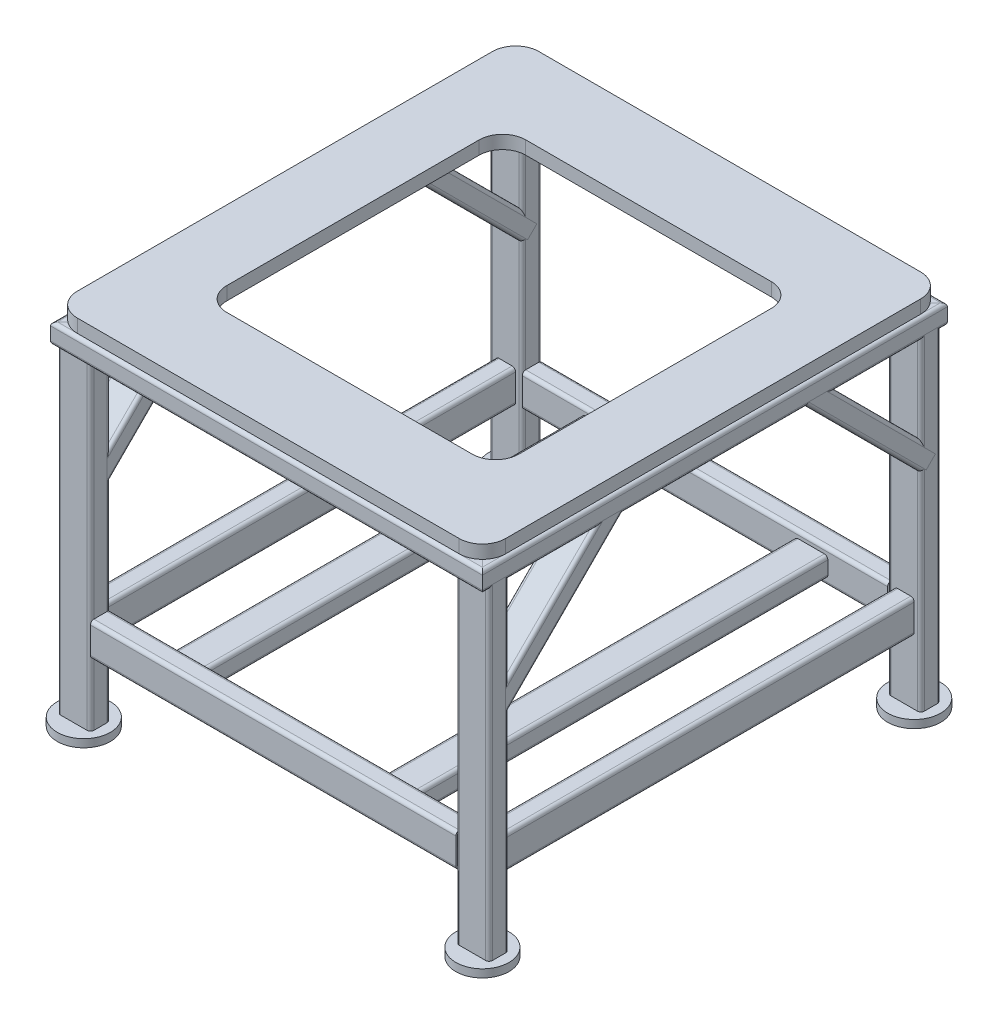
from build123d import *

# Parameters (mm, degrees)
RECTANGULAR_TUBE_50_X_30_X_2_6_1_DEPTH      = 630.154759474
RECTANGULAR_TUBE_50_X_30_X_2_6_1_DEPTH_BACK = 30.154759474
RECTANGULAR_TUBE_50_X_30_X_2_6_1_2_DEPTH    = 710.309518948
RECTANGULAR_TUBE_50_X_30_X_2_6_1_3_DEPTH    = 660.309518948
RECTANGULAR_TUBE_50_X_30_X_2_6_1_4_DEPTH    = 710.309518948
RECTANGULAR_START                           = -310
RECTANGULAR_TUBE_50_X_30_X_2_6_2_DEPTH      = 620
RECTANGULAR_START_2                         = -275
RECTANGULAR_TUBE_50_X_30_X_2_6_2_2_DEPTH    = 550
RECTANGULAR_START_3                         = -500
RECTANGULAR_TUBE_50_X_30_X_2_6_2_3_DEPTH    = 500
RECTANGULAR_TUBE_50_X_30_X_2_6_4_DEPTH      = 254.558441227
RECTANGULAR_TUBE_50_X_30_X_2_6_4_2_DEPTH    = 254.558441227
RECTANGULAR_TUBE_50_X_30_X_2_6_4_3_DEPTH    = 254.558441227
RECTANGULAR_TUBE_50_X_30_X_2_6_4_4_DEPTH    = 254.558441227
BOSS_EXTRUDE1_DEPTH                         = 20
SKETCH21_R                                  = 40
BOSS_EXTRUDE2_DEPTH                         = 12
BOSS_EXTRUDE2_2_DEPTH                       = 12
BOSS_EXTRUDE2_3_DEPTH                       = 12
BOSS_EXTRUDE2_4_DEPTH                       = 12


# Read off the part's stored shape, not the designer's step: Rectangular tube 50 X 30 X 2.6(2)
with BuildPart() as part:
    # Sketch1 → Rectangular tube 50 X 30 X 2.6(1) (new, two sides: drawn at the far end of the back side and taken through both)
    with BuildSketch(Plane(origin=(-300, 0, 325), x_dir=(0, 1, 0), z_dir=(1, 0, 0)).offset(-RECTANGULAR_TUBE_50_X_30_X_2_6_1_DEPTH_BACK)):
        with BuildLine():
            Line((-9.8, -25), (9.8, -25))
            ThreePointArc((9.8, -25), (13.476955262, -23.476955262), (15, -19.8))
            Line((15, -19.8), (15, 19.8))
            ThreePointArc((15, 19.8), (13.476955262, 23.476955262), (9.8, 25))
            Line((9.8, 25), (-9.8, 25))
            ThreePointArc((-9.8, 25), (-13.476955262, 23.476955262), (-15, 19.8))
            Line((-15, 19.8), (-15, -19.8))
            ThreePointArc((-15, -19.8), (-13.476955262, -23.476955262), (-9.8, -25))
        make_face()
        with BuildLine():
            Line((-9.8, -22.4), (9.8, -22.4))
            ThreePointArc((9.8, -22.4), (11.638477631, -21.638477631), (12.4, -19.8))
            Line((12.4, -19.8), (12.4, 19.8))
            ThreePointArc((12.4, 19.8), (11.638477631, 21.638477631), (9.8, 22.4))
            Line((9.8, 22.4), (-9.8, 22.4))
            ThreePointArc((-9.8, 22.4), (-11.638477631, 21.638477631), (-12.4, 19.8))
            Line((-12.4, 19.8), (-12.4, -19.8))
            ThreePointArc((-12.4, -19.8), (-11.638477631, -21.638477631), (-9.8, -22.4))
        make_face(mode=Mode.SUBTRACT)
    extrude(amount=RECTANGULAR_TUBE_50_X_30_X_2_6_1_DEPTH + RECTANGULAR_TUBE_50_X_30_X_2_6_1_DEPTH_BACK)

    # Rectangular tube 50 X 30 X 2.6(1) mitre 1
    split(bisect_by=Plane(origin=(-300, 0, 325), x_dir=(0, 1, 0), z_dir=(0.707106781, 0, 0.707106781)), keep=Keep.TOP)

    # Rectangular tube 50 X 30 X 2.6(1) mitre 2
    split(bisect_by=Plane(origin=(300, 0, 325), x_dir=(0, -1, 0), z_dir=(-0.707106781, 0, 0.707106781)), keep=Keep.TOP)


with BuildPart() as body_2:
    # Sketch1 on segment 2 (carried to segment 2) → Rectangular tube 50 X 30 X 2.6_1 2 (new body)
    with BuildSketch(Plane(origin=(300, 0, 355.154759474), x_dir=(0, 1, 0), z_dir=(0, 0, -1))):
        with BuildLine():
            Line((-9.8, -25), (9.8, -25))
            ThreePointArc((9.8, -25), (13.476955262, -23.476955262), (15, -19.8))
            Line((15, -19.8), (15, 19.8))
            ThreePointArc((15, 19.8), (13.476955262, 23.476955262), (9.8, 25))
            Line((9.8, 25), (-9.8, 25))
            ThreePointArc((-9.8, 25), (-13.476955262, 23.476955262), (-15, 19.8))
            Line((-15, 19.8), (-15, -19.8))
            ThreePointArc((-15, -19.8), (-13.476955262, -23.476955262), (-9.8, -25))
        make_face()
        with BuildLine():
            Line((-9.8, -22.4), (9.8, -22.4))
            ThreePointArc((9.8, -22.4), (11.638477631, -21.638477631), (12.4, -19.8))
            Line((12.4, -19.8), (12.4, 19.8))
            ThreePointArc((12.4, 19.8), (11.638477631, 21.638477631), (9.8, 22.4))
            Line((9.8, 22.4), (-9.8, 22.4))
            ThreePointArc((-9.8, 22.4), (-11.638477631, 21.638477631), (-12.4, 19.8))
            Line((-12.4, 19.8), (-12.4, -19.8))
            ThreePointArc((-12.4, -19.8), (-11.638477631, -21.638477631), (-9.8, -22.4))
        make_face(mode=Mode.SUBTRACT)
    extrude(amount=RECTANGULAR_TUBE_50_X_30_X_2_6_1_2_DEPTH)

    # Rectangular tube 50 X 30 X 2.6_1 2 mitre
    split(bisect_by=Plane(origin=(300, 0, -325), x_dir=(0, 1, 0), z_dir=(0.707106781, 0, 0.707106781)), keep=Keep.TOP)

    # Rectangular tube 50 X 30 X 2.6_1 2 m 2
    split(bisect_by=Plane(origin=(300, 0, 325), x_dir=(0, 1, 0), z_dir=(0.707106781, 0, -0.707106781)), keep=Keep.TOP)


with BuildPart() as body_3:
    # Sketch1 on segment 3 (carried to segment 3) → Rectangular tube 50 X 30 X 2.6_1 3 (new body)
    with BuildSketch(Plane(origin=(330.154759474, 0, -325), x_dir=(0, 1, 0), z_dir=(-1, 0, 0))):
        with BuildLine():
            Line((-9.8, -25), (9.8, -25))
            ThreePointArc((9.8, -25), (13.476955262, -23.476955262), (15, -19.8))
            Line((15, -19.8), (15, 19.8))
            ThreePointArc((15, 19.8), (13.476955262, 23.476955262), (9.8, 25))
            Line((9.8, 25), (-9.8, 25))
            ThreePointArc((-9.8, 25), (-13.476955262, 23.476955262), (-15, 19.8))
            Line((-15, 19.8), (-15, -19.8))
            ThreePointArc((-15, -19.8), (-13.476955262, -23.476955262), (-9.8, -25))
        make_face()
        with BuildLine():
            Line((-9.8, -22.4), (9.8, -22.4))
            ThreePointArc((9.8, -22.4), (11.638477631, -21.638477631), (12.4, -19.8))
            Line((12.4, -19.8), (12.4, 19.8))
            ThreePointArc((12.4, 19.8), (11.638477631, 21.638477631), (9.8, 22.4))
            Line((9.8, 22.4), (-9.8, 22.4))
            ThreePointArc((-9.8, 22.4), (-11.638477631, 21.638477631), (-12.4, 19.8))
            Line((-12.4, 19.8), (-12.4, -19.8))
            ThreePointArc((-12.4, -19.8), (-11.638477631, -21.638477631), (-9.8, -22.4))
        make_face(mode=Mode.SUBTRACT)
    extrude(amount=RECTANGULAR_TUBE_50_X_30_X_2_6_1_3_DEPTH)

    # Rectangular tube 50 X 30 X 2.6_1 3 mitre
    split(bisect_by=Plane(origin=(-300, 0, -325), x_dir=(0, 1, 0), z_dir=(0.707106781, 0, -0.707106781)), keep=Keep.TOP)

    # Rectangular tube 50 X 30 X 2.6_1 3 m 2
    split(bisect_by=Plane(origin=(300, 0, -325), x_dir=(0, -1, 0), z_dir=(-0.707106781, 0, -0.707106781)), keep=Keep.TOP)


with BuildPart() as body_4:
    # Sketch1 on segment 4 (carried to segment 4) → Rectangular tube 50 X 30 X 2.6_1 4 (new body)
    with BuildSketch(Plane(origin=(-300, 0, -355.154759474), x_dir=(0, 1, 0), z_dir=(0, 0, 1))):
        with BuildLine():
            Line((-9.8, -25), (9.8, -25))
            ThreePointArc((9.8, -25), (13.476955262, -23.476955262), (15, -19.8))
            Line((15, -19.8), (15, 19.8))
            ThreePointArc((15, 19.8), (13.476955262, 23.476955262), (9.8, 25))
            Line((9.8, 25), (-9.8, 25))
            ThreePointArc((-9.8, 25), (-13.476955262, 23.476955262), (-15, 19.8))
            Line((-15, 19.8), (-15, -19.8))
            ThreePointArc((-15, -19.8), (-13.476955262, -23.476955262), (-9.8, -25))
        make_face()
        with BuildLine():
            Line((-9.8, -22.4), (9.8, -22.4))
            ThreePointArc((9.8, -22.4), (11.638477631, -21.638477631), (12.4, -19.8))
            Line((12.4, -19.8), (12.4, 19.8))
            ThreePointArc((12.4, 19.8), (11.638477631, 21.638477631), (9.8, 22.4))
            Line((9.8, 22.4), (-9.8, 22.4))
            ThreePointArc((-9.8, 22.4), (-11.638477631, 21.638477631), (-12.4, 19.8))
            Line((-12.4, 19.8), (-12.4, -19.8))
            ThreePointArc((-12.4, -19.8), (-11.638477631, -21.638477631), (-9.8, -22.4))
        make_face(mode=Mode.SUBTRACT)
    extrude(amount=RECTANGULAR_TUBE_50_X_30_X_2_6_1_4_DEPTH)

    # Rectangular tube 50 X 30 X 2.6_1 4 mitre
    split(bisect_by=Plane(origin=(-300, 0, -325), x_dir=(0, -1, 0), z_dir=(-0.707106781, 0, 0.707106781)), keep=Keep.TOP)

    # Rectangular tube 50 X 30 X 2.6_1 4 m 2
    split(bisect_by=Plane(origin=(-300, 0, 325), x_dir=(0, -1, 0), z_dir=(-0.707106781, 0, -0.707106781)), keep=Keep.TOP)


with BuildPart() as body_5:
    # Rectangular tube 50 X 30 X 2.6(2) outline → Rectangular tube 50 X 30 X 2.6(2) (new body)
    # profile 1 of 4: a face of its own
    with BuildSketch(Plane.XY.offset(RECTANGULAR_START)):
        with BuildLine():
            Line((290.2, -405), (309.8, -405))
            ThreePointArc((309.8, -405), (313.476955262, -403.476955262), (315, -399.8))
            Line((315, -399.8), (315, -360.2))
            ThreePointArc((315, -360.2), (313.476955262, -356.523044738), (309.8, -355))
            Line((309.8, -355), (290.2, -355))
            ThreePointArc((290.2, -355), (286.523044738, -356.523044738), (285, -360.2))
            Line((285, -360.2), (285, -399.8))
            ThreePointArc((285, -399.8), (286.523044738, -403.476955262), (290.2, -405))
        make_face()
        with BuildLine():
            ThreePointArc((290.2, -402.4), (288.361522369, -401.638477631), (287.6, -399.8))
            Line((287.6, -399.8), (287.6, -360.2))
            ThreePointArc((287.6, -360.2), (288.361522369, -358.361522369), (290.2, -357.6))
            Line((290.2, -357.6), (309.8, -357.6))
            ThreePointArc((309.8, -357.6), (311.638477631, -358.361522369), (312.4, -360.2))
            Line((312.4, -360.2), (312.4, -399.8))
            ThreePointArc((312.4, -399.8), (311.638477631, -401.638477631), (309.8, -402.4))
            Line((309.8, -402.4), (290.2, -402.4))
        make_face(mode=Mode.SUBTRACT)
    # profile 2 of 4: a face of its own
    with BuildSketch(Plane.XY.offset(RECTANGULAR_START)):
        with BuildLine():
            Line((-309.8, -405), (-290.2, -405))
            ThreePointArc((-290.2, -405), (-286.523044738, -403.476955262), (-285, -399.8))
            Line((-285, -399.8), (-285, -360.2))
            ThreePointArc((-285, -360.2), (-286.523044738, -356.523044738), (-290.2, -355))
            Line((-290.2, -355), (-309.8, -355))
            ThreePointArc((-309.8, -355), (-313.476955262, -356.523044738), (-315, -360.2))
            Line((-315, -360.2), (-315, -399.8))
            ThreePointArc((-315, -399.8), (-313.476955262, -403.476955262), (-309.8, -405))
        make_face()
        with BuildLine():
            ThreePointArc((-287.6, -399.8), (-288.361522369, -401.638477631), (-290.2, -402.4))
            Line((-290.2, -402.4), (-309.8, -402.4))
            ThreePointArc((-309.8, -402.4), (-311.638477631, -401.638477631), (-312.4, -399.8))
            Line((-312.4, -399.8), (-312.4, -360.2))
            ThreePointArc((-312.4, -360.2), (-311.638477631, -358.361522369), (-309.8, -357.6))
            Line((-309.8, -357.6), (-290.2, -357.6))
            ThreePointArc((-290.2, -357.6), (-288.361522369, -358.361522369), (-287.6, -360.2))
            Line((-287.6, -360.2), (-287.6, -399.8))
        make_face(mode=Mode.SUBTRACT)
    # profile 3 of 4: a face of its own
    with BuildSketch(Plane.XY.offset(RECTANGULAR_START)):
        with BuildLine():
            ThreePointArc((-179.8, -365), (-183.476955262, -366.523044738), (-185, -370.2))
            Line((-185, -370.2), (-185, -389.8))
            ThreePointArc((-185, -389.8), (-183.476955262, -393.476955262), (-179.8, -395))
            Line((-179.8, -395), (-140.2, -395))
            ThreePointArc((-140.2, -395), (-136.523044738, -393.476955262), (-135, -389.8))
            Line((-135, -389.8), (-135, -370.2))
            ThreePointArc((-135, -370.2), (-136.523044738, -366.523044738), (-140.2, -365))
            Line((-140.2, -365), (-179.8, -365))
        make_face()
        with BuildLine():
            Line((-140.2, -392.4), (-179.8, -392.4))
            ThreePointArc((-179.8, -392.4), (-181.638477631, -391.638477631), (-182.4, -389.8))
            Line((-182.4, -389.8), (-182.4, -370.2))
            ThreePointArc((-182.4, -370.2), (-181.638477631, -368.361522369), (-179.8, -367.6))
            Line((-179.8, -367.6), (-140.2, -367.6))
            ThreePointArc((-140.2, -367.6), (-138.361522369, -368.361522369), (-137.6, -370.2))
            Line((-137.6, -370.2), (-137.6, -389.8))
            ThreePointArc((-137.6, -389.8), (-138.361522369, -391.638477631), (-140.2, -392.4))
        make_face(mode=Mode.SUBTRACT)
    # profile 4 of 4: a face of its own
    with BuildSketch(Plane.XY.offset(RECTANGULAR_START)):
        with BuildLine():
            Line((140.2, -395), (179.8, -395))
            ThreePointArc((179.8, -395), (183.476955262, -393.476955262), (185, -389.8))
            Line((185, -389.8), (185, -370.2))
            ThreePointArc((185, -370.2), (183.476955262, -366.523044738), (179.8, -365))
            Line((179.8, -365), (140.2, -365))
            ThreePointArc((140.2, -365), (136.523044738, -366.523044738), (135, -370.2))
            Line((135, -370.2), (135, -389.8))
            ThreePointArc((135, -389.8), (136.523044738, -393.476955262), (140.2, -395))
        make_face()
        with BuildLine():
            ThreePointArc((137.6, -370.2), (138.361522369, -368.361522369), (140.2, -367.6))
            Line((140.2, -367.6), (179.8, -367.6))
            ThreePointArc((179.8, -367.6), (181.638477631, -368.361522369), (182.4, -370.2))
            Line((182.4, -370.2), (182.4, -389.8))
            ThreePointArc((182.4, -389.8), (181.638477631, -391.638477631), (179.8, -392.4))
            Line((179.8, -392.4), (140.2, -392.4))
            ThreePointArc((140.2, -392.4), (138.361522369, -391.638477631), (137.6, -389.8))
            Line((137.6, -389.8), (137.6, -370.2))
        make_face(mode=Mode.SUBTRACT)
    extrude(amount=RECTANGULAR_TUBE_50_X_30_X_2_6_2_DEPTH)


with BuildPart() as body_6:
    # Rectangular tube 50 X 30 X 2.6_2 2 outli → Rectangular tube 50 X 30 X 2.6_2 2 (new body)
    # profile 1 of 2: a face of its own
    with BuildSketch(Plane.YZ.offset(RECTANGULAR_START_2)):
        with BuildLine():
            Line((-405, 334.8), (-405, 315.2))
            ThreePointArc((-405, 315.2), (-403.476955262, 311.523044738), (-399.8, 310))
            Line((-399.8, 310), (-360.2, 310))
            ThreePointArc((-360.2, 310), (-356.523044738, 311.523044738), (-355, 315.2))
            Line((-355, 315.2), (-355, 334.8))
            ThreePointArc((-355, 334.8), (-356.523044738, 338.476955262), (-360.2, 340))
            Line((-360.2, 340), (-399.8, 340))
            ThreePointArc((-399.8, 340), (-403.476955262, 338.476955262), (-405, 334.8))
        make_face()
        with BuildLine():
            ThreePointArc((-399.8, 312.6), (-401.638477631, 313.361522369), (-402.4, 315.2))
            Line((-402.4, 315.2), (-402.4, 334.8))
            ThreePointArc((-402.4, 334.8), (-401.638477631, 336.638477631), (-399.8, 337.4))
            Line((-399.8, 337.4), (-360.2, 337.4))
            ThreePointArc((-360.2, 337.4), (-358.361522369, 336.638477631), (-357.6, 334.8))
            Line((-357.6, 334.8), (-357.6, 315.2))
            ThreePointArc((-357.6, 315.2), (-358.361522369, 313.361522369), (-360.2, 312.6))
            Line((-360.2, 312.6), (-399.8, 312.6))
        make_face(mode=Mode.SUBTRACT)
    # profile 2 of 2: a face of its own
    with BuildSketch(Plane.YZ.offset(RECTANGULAR_START_2)):
        with BuildLine():
            Line((-405, -315.2), (-405, -334.8))
            ThreePointArc((-405, -334.8), (-403.476955262, -338.476955262), (-399.8, -340))
            Line((-399.8, -340), (-360.2, -340))
            ThreePointArc((-360.2, -340), (-356.523044738, -338.476955262), (-355, -334.8))
            Line((-355, -334.8), (-355, -315.2))
            ThreePointArc((-355, -315.2), (-356.523044738, -311.523044738), (-360.2, -310))
            Line((-360.2, -310), (-399.8, -310))
            ThreePointArc((-399.8, -310), (-403.476955262, -311.523044738), (-405, -315.2))
        make_face()
        with BuildLine():
            ThreePointArc((-399.8, -337.4), (-401.638477631, -336.638477631), (-402.4, -334.8))
            Line((-402.4, -334.8), (-402.4, -315.2))
            ThreePointArc((-402.4, -315.2), (-401.638477631, -313.361522369), (-399.8, -312.6))
            Line((-399.8, -312.6), (-360.2, -312.6))
            ThreePointArc((-360.2, -312.6), (-358.361522369, -313.361522369), (-357.6, -315.2))
            Line((-357.6, -315.2), (-357.6, -334.8))
            ThreePointArc((-357.6, -334.8), (-358.361522369, -336.638477631), (-360.2, -337.4))
            Line((-360.2, -337.4), (-399.8, -337.4))
        make_face(mode=Mode.SUBTRACT)
    extrude(amount=RECTANGULAR_TUBE_50_X_30_X_2_6_2_2_DEPTH)


with BuildPart() as body_7:
    # Rectangular tube 50 X 30 X 2.6_2 3 outli → Rectangular tube 50 X 30 X 2.6_2 3 (new body)
    # profile 1 of 4: a face of its own
    with BuildSketch(Plane(origin=(0, 0, 0), x_dir=(1, 0, 0), z_dir=(0, 1, 0)).offset(RECTANGULAR_START_3)):
        with BuildLine():
            Line((319.8, -310), (280.2, -310))
            ThreePointArc((280.2, -310), (276.523044738, -311.523044738), (275, -315.2))
            Line((275, -315.2), (275, -334.8))
            ThreePointArc((275, -334.8), (276.523044738, -338.476955262), (280.2, -340))
            Line((280.2, -340), (319.8, -340))
            ThreePointArc((319.8, -340), (323.476955262, -338.476955262), (325, -334.8))
            Line((325, -334.8), (325, -315.2))
            ThreePointArc((325, -315.2), (323.476955262, -311.523044738), (319.8, -310))
        make_face()
        with BuildLine():
            ThreePointArc((322.4, -334.8), (321.638477631, -336.638477631), (319.8, -337.4))
            Line((319.8, -337.4), (280.2, -337.4))
            ThreePointArc((280.2, -337.4), (278.361522369, -336.638477631), (277.6, -334.8))
            Line((277.6, -334.8), (277.6, -315.2))
            ThreePointArc((277.6, -315.2), (278.361522369, -313.361522369), (280.2, -312.6))
            Line((280.2, -312.6), (319.8, -312.6))
            ThreePointArc((319.8, -312.6), (321.638477631, -313.361522369), (322.4, -315.2))
            Line((322.4, -315.2), (322.4, -334.8))
        make_face(mode=Mode.SUBTRACT)
    # profile 2 of 4: a face of its own
    with BuildSketch(Plane(origin=(0, 0, 0), x_dir=(1, 0, 0), z_dir=(0, 1, 0)).offset(RECTANGULAR_START_3)):
        with BuildLine():
            Line((-280.2, -310), (-319.8, -310))
            ThreePointArc((-319.8, -310), (-323.476955262, -311.523044738), (-325, -315.2))
            Line((-325, -315.2), (-325, -334.8))
            ThreePointArc((-325, -334.8), (-323.476955262, -338.476955262), (-319.8, -340))
            Line((-319.8, -340), (-280.2, -340))
            ThreePointArc((-280.2, -340), (-276.523044738, -338.476955262), (-275, -334.8))
            Line((-275, -334.8), (-275, -315.2))
            ThreePointArc((-275, -315.2), (-276.523044738, -311.523044738), (-280.2, -310))
        make_face()
        with BuildLine():
            ThreePointArc((-277.6, -334.8), (-278.361522369, -336.638477631), (-280.2, -337.4))
            Line((-280.2, -337.4), (-319.8, -337.4))
            ThreePointArc((-319.8, -337.4), (-321.638477631, -336.638477631), (-322.4, -334.8))
            Line((-322.4, -334.8), (-322.4, -315.2))
            ThreePointArc((-322.4, -315.2), (-321.638477631, -313.361522369), (-319.8, -312.6))
            Line((-319.8, -312.6), (-280.2, -312.6))
            ThreePointArc((-280.2, -312.6), (-278.361522369, -313.361522369), (-277.6, -315.2))
            Line((-277.6, -315.2), (-277.6, -334.8))
        make_face(mode=Mode.SUBTRACT)
    # profile 3 of 4: a face of its own
    with BuildSketch(Plane(origin=(0, 0, 0), x_dir=(1, 0, 0), z_dir=(0, 1, 0)).offset(RECTANGULAR_START_3)):
        with BuildLine():
            Line((280.2, 310), (319.8, 310))
            ThreePointArc((319.8, 310), (323.476955262, 311.523044738), (325, 315.2))
            Line((325, 315.2), (325, 334.8))
            ThreePointArc((325, 334.8), (323.476955262, 338.476955262), (319.8, 340))
            Line((319.8, 340), (280.2, 340))
            ThreePointArc((280.2, 340), (276.523044738, 338.476955262), (275, 334.8))
            Line((275, 334.8), (275, 315.2))
            ThreePointArc((275, 315.2), (276.523044738, 311.523044738), (280.2, 310))
        make_face()
        with BuildLine():
            ThreePointArc((277.6, 334.8), (278.361522369, 336.638477631), (280.2, 337.4))
            Line((280.2, 337.4), (319.8, 337.4))
            ThreePointArc((319.8, 337.4), (321.638477631, 336.638477631), (322.4, 334.8))
            Line((322.4, 334.8), (322.4, 315.2))
            ThreePointArc((322.4, 315.2), (321.638477631, 313.361522369), (319.8, 312.6))
            Line((319.8, 312.6), (280.2, 312.6))
            ThreePointArc((280.2, 312.6), (278.361522369, 313.361522369), (277.6, 315.2))
            Line((277.6, 315.2), (277.6, 334.8))
        make_face(mode=Mode.SUBTRACT)
    # profile 4 of 4: a face of its own
    with BuildSketch(Plane(origin=(0, 0, 0), x_dir=(1, 0, 0), z_dir=(0, 1, 0)).offset(RECTANGULAR_START_3)):
        with BuildLine():
            Line((-319.8, 310), (-280.2, 310))
            ThreePointArc((-280.2, 310), (-276.523044738, 311.523044738), (-275, 315.2))
            Line((-275, 315.2), (-275, 334.8))
            ThreePointArc((-275, 334.8), (-276.523044738, 338.476955262), (-280.2, 340))
            Line((-280.2, 340), (-319.8, 340))
            ThreePointArc((-319.8, 340), (-323.476955262, 338.476955262), (-325, 334.8))
            Line((-325, 334.8), (-325, 315.2))
            ThreePointArc((-325, 315.2), (-323.476955262, 311.523044738), (-319.8, 310))
        make_face()
        with BuildLine():
            ThreePointArc((-322.4, 334.8), (-321.638477631, 336.638477631), (-319.8, 337.4))
            Line((-319.8, 337.4), (-280.2, 337.4))
            ThreePointArc((-280.2, 337.4), (-278.361522369, 336.638477631), (-277.6, 334.8))
            Line((-277.6, 334.8), (-277.6, 315.2))
            ThreePointArc((-277.6, 315.2), (-278.361522369, 313.361522369), (-280.2, 312.6))
            Line((-280.2, 312.6), (-319.8, 312.6))
            ThreePointArc((-319.8, 312.6), (-321.638477631, 313.361522369), (-322.4, 315.2))
            Line((-322.4, 315.2), (-322.4, 334.8))
        make_face(mode=Mode.SUBTRACT)
    extrude(amount=RECTANGULAR_TUBE_50_X_30_X_2_6_2_3_DEPTH)


with BuildPart() as body_8:
    # Sketch19 → Rectangular tube 50 X 30 X 2.6(4) (new body)
    with BuildSketch(Plane(origin=(-300, -180, 325), x_dir=(0, 0.7071067811865437, 0.7071067811865515), z_dir=(0, 0.7071067811865515, -0.7071067811865437))):
        with BuildLine():
            Line((-9.8, -25), (9.8, -25))
            ThreePointArc((9.8, -25), (13.476955262, -23.476955262), (15, -19.8))
            Line((15, -19.8), (15, 19.8))
            ThreePointArc((15, 19.8), (13.476955262, 23.476955262), (9.8, 25))
            Line((9.8, 25), (-9.8, 25))
            ThreePointArc((-9.8, 25), (-13.476955262, 23.476955262), (-15, 19.8))
            Line((-15, 19.8), (-15, -19.8))
            ThreePointArc((-15, -19.8), (-13.476955262, -23.476955262), (-9.8, -25))
        make_face()
        with BuildLine():
            Line((-9.8, -22.4), (9.8, -22.4))
            ThreePointArc((9.8, -22.4), (11.638477631, -21.638477631), (12.4, -19.8))
            Line((12.4, -19.8), (12.4, 19.8))
            ThreePointArc((12.4, 19.8), (11.638477631, 21.638477631), (9.8, 22.4))
            Line((9.8, 22.4), (-9.8, 22.4))
            ThreePointArc((-9.8, 22.4), (-11.638477631, 21.638477631), (-12.4, 19.8))
            Line((-12.4, 19.8), (-12.4, -19.8))
            ThreePointArc((-12.4, -19.8), (-11.638477631, -21.638477631), (-9.8, -22.4))
        make_face(mode=Mode.SUBTRACT)
    extrude(amount=RECTANGULAR_TUBE_50_X_30_X_2_6_4_DEPTH)


with BuildPart() as body_9:
    # Sketch19 on segment 2 (carried to segment 2) → Rectangular tube 50 X 30 X 2.6_4 2 (new body)
    with BuildSketch(Plane(origin=(300, -180, 325), x_dir=(0, 0.707106781, 0.707106781), z_dir=(0, 0.707106781, -0.707106781))):
        with BuildLine():
            Line((-9.8, -25), (9.8, -25))
            ThreePointArc((9.8, -25), (13.476955262, -23.476955262), (15, -19.8))
            Line((15, -19.8), (15, 19.8))
            ThreePointArc((15, 19.8), (13.476955262, 23.476955262), (9.8, 25))
            Line((9.8, 25), (-9.8, 25))
            ThreePointArc((-9.8, 25), (-13.476955262, 23.476955262), (-15, 19.8))
            Line((-15, 19.8), (-15, -19.8))
            ThreePointArc((-15, -19.8), (-13.476955262, -23.476955262), (-9.8, -25))
        make_face()
        with BuildLine():
            Line((-9.8, -22.4), (9.8, -22.4))
            ThreePointArc((9.8, -22.4), (11.638477631, -21.638477631), (12.4, -19.8))
            Line((12.4, -19.8), (12.4, 19.8))
            ThreePointArc((12.4, 19.8), (11.638477631, 21.638477631), (9.8, 22.4))
            Line((9.8, 22.4), (-9.8, 22.4))
            ThreePointArc((-9.8, 22.4), (-11.638477631, 21.638477631), (-12.4, 19.8))
            Line((-12.4, 19.8), (-12.4, -19.8))
            ThreePointArc((-12.4, -19.8), (-11.638477631, -21.638477631), (-9.8, -22.4))
        make_face(mode=Mode.SUBTRACT)
    extrude(amount=RECTANGULAR_TUBE_50_X_30_X_2_6_4_2_DEPTH)


with BuildPart() as body_10:
    # Sketch19 on segment 3 (carried to segment 3) → Rectangular tube 50 X 30 X 2.6_4 3 (new body)
    with BuildSketch(Plane(origin=(300, 0, -145), x_dir=(0, 0.707106781, -0.707106781), z_dir=(0, -0.707106781, -0.707106781))):
        with BuildLine():
            Line((-9.8, -25), (9.8, -25))
            ThreePointArc((9.8, -25), (13.476955262, -23.476955262), (15, -19.8))
            Line((15, -19.8), (15, 19.8))
            ThreePointArc((15, 19.8), (13.476955262, 23.476955262), (9.8, 25))
            Line((9.8, 25), (-9.8, 25))
            ThreePointArc((-9.8, 25), (-13.476955262, 23.476955262), (-15, 19.8))
            Line((-15, 19.8), (-15, -19.8))
            ThreePointArc((-15, -19.8), (-13.476955262, -23.476955262), (-9.8, -25))
        make_face()
        with BuildLine():
            Line((-9.8, -22.4), (9.8, -22.4))
            ThreePointArc((9.8, -22.4), (11.638477631, -21.638477631), (12.4, -19.8))
            Line((12.4, -19.8), (12.4, 19.8))
            ThreePointArc((12.4, 19.8), (11.638477631, 21.638477631), (9.8, 22.4))
            Line((9.8, 22.4), (-9.8, 22.4))
            ThreePointArc((-9.8, 22.4), (-11.638477631, 21.638477631), (-12.4, 19.8))
            Line((-12.4, 19.8), (-12.4, -19.8))
            ThreePointArc((-12.4, -19.8), (-11.638477631, -21.638477631), (-9.8, -22.4))
        make_face(mode=Mode.SUBTRACT)
    extrude(amount=RECTANGULAR_TUBE_50_X_30_X_2_6_4_3_DEPTH)


with BuildPart() as body_11:
    # Sketch19 on segment 4 (carried to segment 4) → Rectangular tube 50 X 30 X 2.6_4 4 (new body)
    with BuildSketch(Plane(origin=(-300, 0, -145), x_dir=(0, 0.707106781, -0.707106781), z_dir=(0, -0.707106781, -0.707106781))):
        with BuildLine():
            Line((-9.8, -25), (9.8, -25))
            ThreePointArc((9.8, -25), (13.476955262, -23.476955262), (15, -19.8))
            Line((15, -19.8), (15, 19.8))
            ThreePointArc((15, 19.8), (13.476955262, 23.476955262), (9.8, 25))
            Line((9.8, 25), (-9.8, 25))
            ThreePointArc((-9.8, 25), (-13.476955262, 23.476955262), (-15, 19.8))
            Line((-15, 19.8), (-15, -19.8))
            ThreePointArc((-15, -19.8), (-13.476955262, -23.476955262), (-9.8, -25))
        make_face()
        with BuildLine():
            Line((-9.8, -22.4), (9.8, -22.4))
            ThreePointArc((9.8, -22.4), (11.638477631, -21.638477631), (12.4, -19.8))
            Line((12.4, -19.8), (12.4, 19.8))
            ThreePointArc((12.4, 19.8), (11.638477631, 21.638477631), (9.8, 22.4))
            Line((9.8, 22.4), (-9.8, 22.4))
            ThreePointArc((-9.8, 22.4), (-11.638477631, 21.638477631), (-12.4, 19.8))
            Line((-12.4, 19.8), (-12.4, -19.8))
            ThreePointArc((-12.4, -19.8), (-11.638477631, -21.638477631), (-9.8, -22.4))
        make_face(mode=Mode.SUBTRACT)
    extrude(amount=RECTANGULAR_TUBE_50_X_30_X_2_6_4_4_DEPTH)


with BuildPart() as body_12:
    # Sketch20 → Boss-Extrude1 (new body)
    with BuildSketch(Plane(origin=(0, 15, 0), x_dir=(1, 0, 0), z_dir=(0, 1, 0))):
        with BuildLine():
            Line((-290, 350), (284.8, 350))
            ThreePointArc((284.8, 350), (309.548737342, 339.748737342), (319.8, 315))
            Line((319.8, 315), (319.8, -309.8))
            ThreePointArc((319.8, -309.8), (309.548737342, -334.548737342), (284.8, -344.8))
            Line((284.8, -344.8), (-290, -344.8))
            ThreePointArc((-290, -344.8), (-314.748737342, -334.548737342), (-325, -309.8))
            Line((-325, -309.8), (-325, 315))
            ThreePointArc((-325, 315), (-314.748737342, 339.748737342), (-290, 350))
        make_face()
        with BuildLine():
            Line((-184.8, 225), (184.8, 225))
            ThreePointArc((184.8, 225), (209.548737342, 214.748737342), (219.8, 190))
            Line((219.8, 190), (219.8, -190))
            ThreePointArc((219.8, -190), (209.548737342, -214.748737342), (184.8, -225))
            Line((184.8, -225), (-184.8, -225))
            ThreePointArc((-184.8, -225), (-209.548737342, -214.748737342), (-219.8, -190))
            Line((-219.8, -190), (-219.8, 190))
            ThreePointArc((-219.8, 190), (-209.548737342, 214.748737342), (-184.8, 225))
        make_face(mode=Mode.SUBTRACT)
    extrude(amount=BOSS_EXTRUDE1_DEPTH)


with BuildPart() as body_13:
    # Sketch21 → Boss-Extrude2 (new body)
    with BuildSketch(Plane.XZ.offset(500)):
        with Locations((-300, -325)):
            Circle(SKETCH21_R)
    extrude(amount=BOSS_EXTRUDE2_DEPTH)


with BuildPart() as body_14:
    # Sketch21 → Boss-Extrude2 2 (new body)
    with BuildSketch(Plane.XZ.offset(500)):
        with Locations((300, -325)):
            Circle(SKETCH21_R)
    extrude(amount=BOSS_EXTRUDE2_2_DEPTH)


with BuildPart() as body_15:
    # Sketch21 → Boss-Extrude2 3 (new body)
    with BuildSketch(Plane.XZ.offset(500)):
        with Locations((300, 325)):
            Circle(SKETCH21_R)
    extrude(amount=BOSS_EXTRUDE2_3_DEPTH)


with BuildPart() as body_16:
    # Sketch21 → Boss-Extrude2 4 (new body)
    with BuildSketch(Plane.XZ.offset(500)):
        with Locations((-300, 325)):
            Circle(SKETCH21_R)
    extrude(amount=BOSS_EXTRUDE2_4_DEPTH)


solid = Compound([part.part, body_2.part, body_3.part, body_4.part, body_5.part, body_6.part, body_7.part, body_8.part, body_9.part, body_10.part, body_11.part, body_12.part, body_13.part, body_14.part, body_15.part, body_16.part])
